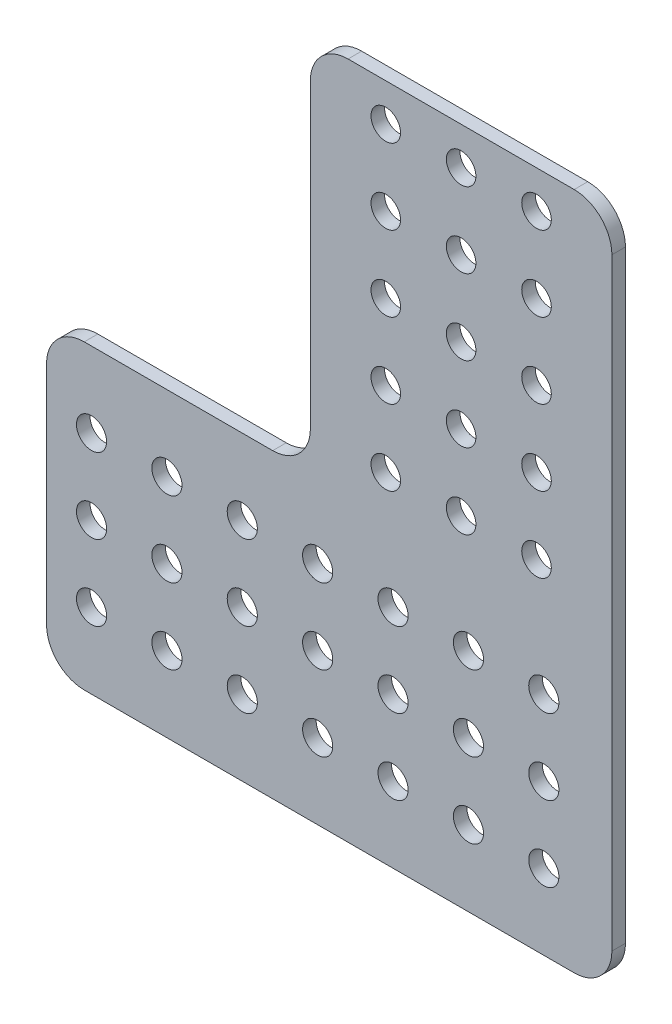
from build123d import *

# Parameters (mm, degrees)
SKETCH1_R           = 2.54
SKETCH1_R_2         = 2.4892
BOSS_EXTRUDE1_DEPTH = 2.286
FILLET1_R           = 6.35


with BuildPart() as part:
    # Sketch1 → Boss-Extrude1 (new body)
    with BuildSketch(Plane(origin=(0, 0, -219.608471563), x_dir=(-1, 0, 0), z_dir=(0, 0, -1))):
        Polygon((77.53656774, 159.000825673), (77.53656774, 108.200825673), (-17.71343226, 108.200825673), (-17.71343226, 222.500825674), (33.08656774, 222.500825674), (33.08656774, 159.000825673), align=None)
        with Locations((44.553419861, 120.900826428)):
            Circle(SKETCH1_R, mode=Mode.SUBTRACT)
        with Locations((57.257798242, 133.600825673)):
            Circle(SKETCH1_R, mode=Mode.SUBTRACT)
        with Locations((69.957798242, 146.300825673)):
            Circle(SKETCH1_R, mode=Mode.SUBTRACT)
        with Locations((69.957798242, 133.600825673)):
            Circle(SKETCH1_R, mode=Mode.SUBTRACT)
        with Locations((69.957798242, 120.900825673)):
            Circle(SKETCH1_R, mode=Mode.SUBTRACT)
        with Locations((57.253419861, 120.900826428)):
            Circle(SKETCH1_R, mode=Mode.SUBTRACT)
        with Locations((20.38656774, 165.350825674)):
            Circle(SKETCH1_R_2, mode=Mode.SUBTRACT)
        with Locations((-6.242201758, 146.300824919)):
            Circle(SKETCH1_R, mode=Mode.SUBTRACT)
        with Locations((-6.246580139, 133.600825673)):
            Circle(SKETCH1_R, mode=Mode.SUBTRACT)
        with Locations((6.457798242, 146.300825673)):
            Circle(SKETCH1_R, mode=Mode.SUBTRACT)
        with Locations((6.453419861, 133.600826428)):
            Circle(SKETCH1_R, mode=Mode.SUBTRACT)
        with Locations((19.157798242, 146.300825673)):
            Circle(SKETCH1_R, mode=Mode.SUBTRACT)
        with Locations((-6.246580139, 120.900825673)):
            Circle(SKETCH1_R, mode=Mode.SUBTRACT)
        with Locations((6.453419861, 120.900826428)):
            Circle(SKETCH1_R, mode=Mode.SUBTRACT)
        with Locations((19.153419861, 120.900826428)):
            Circle(SKETCH1_R, mode=Mode.SUBTRACT)
        with Locations((19.157798242, 133.600825673)):
            Circle(SKETCH1_R, mode=Mode.SUBTRACT)
        with Locations((31.857798242, 133.600825673)):
            Circle(SKETCH1_R, mode=Mode.SUBTRACT)
        with Locations((44.557798242, 133.600825673)):
            Circle(SKETCH1_R, mode=Mode.SUBTRACT)
        with Locations((31.857798242, 146.300825673)):
            Circle(SKETCH1_R, mode=Mode.SUBTRACT)
        with Locations((44.557798242, 146.300825673)):
            Circle(SKETCH1_R, mode=Mode.SUBTRACT)
        with Locations((57.257798242, 146.300825673)):
            Circle(SKETCH1_R, mode=Mode.SUBTRACT)
        with Locations((31.853419861, 120.900826428)):
            Circle(SKETCH1_R, mode=Mode.SUBTRACT)
        with Locations((-5.01343226, 216.150825674)):
            Circle(SKETCH1_R_2, mode=Mode.SUBTRACT)
        with Locations((7.68656774, 216.150825674)):
            Circle(SKETCH1_R_2, mode=Mode.SUBTRACT)
        with Locations((20.38656774, 216.150825674)):
            Circle(SKETCH1_R_2, mode=Mode.SUBTRACT)
        with Locations((-5.01343226, 203.450825674)):
            Circle(SKETCH1_R_2, mode=Mode.SUBTRACT)
        with Locations((7.68656774, 203.450825674)):
            Circle(SKETCH1_R_2, mode=Mode.SUBTRACT)
        with Locations((20.38656774, 203.450825674)):
            Circle(SKETCH1_R_2, mode=Mode.SUBTRACT)
        with Locations((-5.01343226, 190.750825674)):
            Circle(SKETCH1_R_2, mode=Mode.SUBTRACT)
        with Locations((7.68656774, 190.750825674)):
            Circle(SKETCH1_R_2, mode=Mode.SUBTRACT)
        with Locations((20.38656774, 190.750825674)):
            Circle(SKETCH1_R_2, mode=Mode.SUBTRACT)
        with Locations((-5.01343226, 178.050825674)):
            Circle(SKETCH1_R_2, mode=Mode.SUBTRACT)
        with Locations((7.68656774, 178.050825674)):
            Circle(SKETCH1_R_2, mode=Mode.SUBTRACT)
        with Locations((20.38656774, 178.050825674)):
            Circle(SKETCH1_R_2, mode=Mode.SUBTRACT)
        with Locations((-5.01343226, 165.350825674)):
            Circle(SKETCH1_R_2, mode=Mode.SUBTRACT)
        with Locations((7.68656774, 165.350825674)):
            Circle(SKETCH1_R_2, mode=Mode.SUBTRACT)
    extrude(amount=BOSS_EXTRUDE1_DEPTH)

    # Fillet1
    fillet1_edges = [part.edges().sort_by_distance(p)[0] for p in [
        (17.71343226, 108.200825673, -220.751471563),
        (17.71343226, 222.500825674, -220.751471563),
        (-33.08656774, 159.000825673, -220.751471563),
        (-33.08656774, 222.500825674, -220.751471563),
        (-77.53656774, 108.200825673, -220.751471563),
        (-77.53656774, 159.000825673, -220.751471563),
    ]]
    fillet(fillet1_edges, radius=FILLET1_R)


solid = part.part
